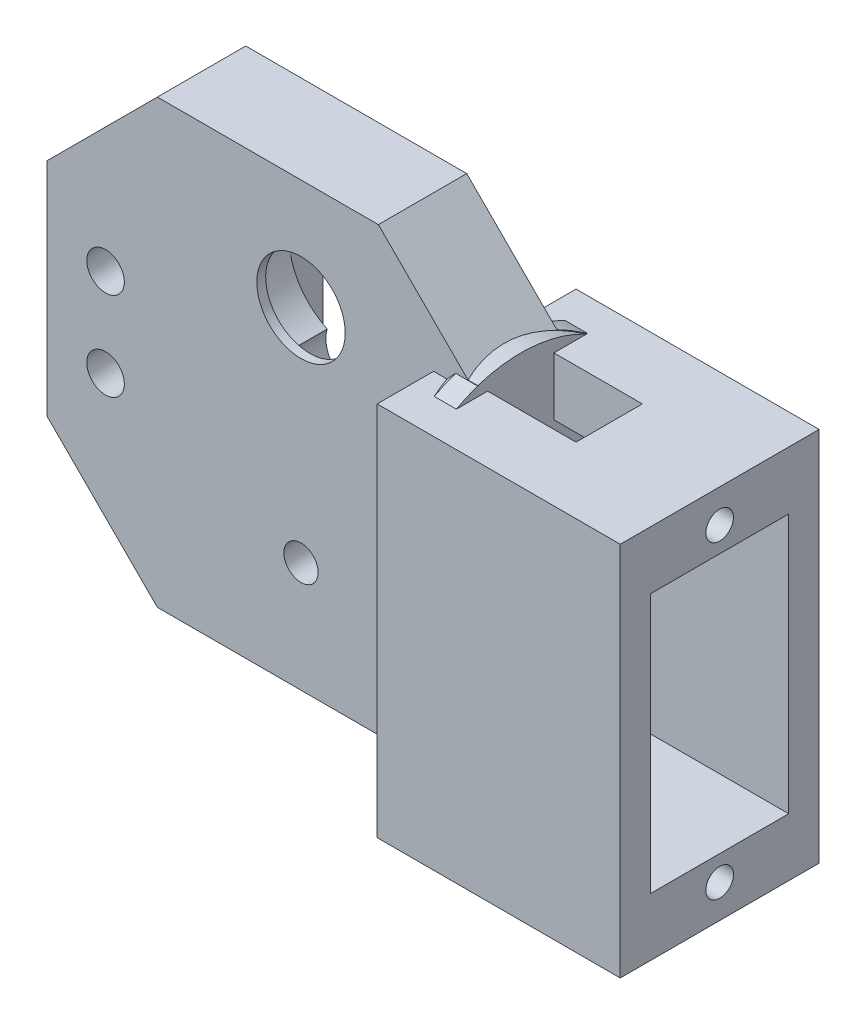
from build123d import *

# Parameters (mm, degrees)
SKETCH_1_W                = 50
SKETCH_1_H                = 40
EXTRUDE_1_DEPTH           = 8
CHAMFER_1_SIZE            = 10
SKETCH_2_R                = 1.55
CUT_EXTRUDE_1_DEPTH       = 10
EXTRUDE_2_DEPTH           = 40
EXTRUDE_2_DEPTH_BACK      = 15
SKETCH_3_R                = 12.5
SKETCH_4_R                = 1.7
CUT_EXTRUDE_2_DEPTH       = 15
CUT_EXTRUDE_START         = -20
CUT_EXTRUDE_3_DEPTH       = 20
SKETCH_7_R                = 16.5
CUT_EXTRUDE_8_DEPTH       = 33
CUT_EXTRUDE_9_DEPTH       = 20
CHAMFER_3_SIZE            = 2
SKETCH_10_OUTSIDE_W       = 47.322
SKETCH_10_OUTSIDE_H       = 62.322
SKETCH_10_OUTSIDE_R       = 12.5
CUT_EXTRUDE_10_DEPTH      = 10
CHAMFER_4_SIZE            = 10
SKETCH_12_W               = 1.5
SKETCH_12_H               = 20
SKETCH_14_W               = 12
SKETCH_14_H               = 23
CUT_EXTRUDE_11_DEPTH      = 3
CUT_EXTRUDE_12_DEPTH      = 4.2
SKETCH_16_R               = 1.1
CUT_EXTRUDE_13_DEPTH      = 5
SKETCH_17_R               = 3.372674955
EXTRUDE_3_DEPTH           = 4
SKETCH_18_R               = 1.1
CUT_EXTRUDE_14_DEPTH      = 4
SKETCH_20_R               = 4
CUT_EXTRUDE_15_DEPTH      = 4
CUT_EXTRUDE_16_DEPTH      = 70.980354503
CUT_EXTRUDE_16_DEPTH_BACK = 70.980354503
SKETCH_21_W               = 56.3061188
SKETCH_21_H               = 46.683670243
EXTRUDE_4_DEPTH           = 18
EXTRUDE_4_DEPTH_BACK      = 4
SKETCH_22_W               = 18
SKETCH_22_H               = 34
SKETCH_23_W               = 12.5
SKETCH_23_H               = 23.5
CUT_EXTRUDE_17_DEPTH      = 18
SKETCH_24_R               = 1.25
CUT_EXTRUDE_18_DEPTH      = 8
CUT_EXTRUDE_19_DEPTH      = 64.641574462
SKETCH_26_W               = 8
SKETCH_26_H               = 6
CUT_EXTRUDE_20_DEPTH      = 20


# Read off the part's stored shape, not the designer's step: 切除-拉伸3
with BuildPart() as part:
    # 草图1 → 凸台-拉伸1 (new body)
    with BuildSketch(Plane.XY):
        Rectangle(SKETCH_1_W, SKETCH_1_H)
    extrude(amount=EXTRUDE_1_DEPTH)

    # 倒角1
    chamfer_1_edges = [part.edges().sort_by_distance(p)[0] for p in [
        (-25, -20, 4),
        (-25, 20, 4),
    ]]
    chamfer(chamfer_1_edges, length=CHAMFER_1_SIZE)

    # 草图2 → 切除-拉伸1 (cut)
    with BuildSketch(Plane.XY.offset(8)):
        with Locations((-2, -10)):
            Circle(SKETCH_2_R)
        with Locations((-2, 10)):
            Circle(SKETCH_2_R)
    extrude(amount=-CUT_EXTRUDE_1_DEPTH, mode=Mode.SUBTRACT)

    # 草图3 → 凸台-拉伸2 (add, two sides: drawn at the far end of the back side and taken through both)
    with BuildSketch(Plane(origin=(25, 0, 0), x_dir=(0, 0, -1), z_dir=(1, 0, 0)).offset(-EXTRUDE_2_DEPTH_BACK)):
        with Locations(Location((-4, 0, 0), (0, 0, 251.337075115))):
            Circle(SKETCH_3_R)
    extrude(amount=EXTRUDE_2_DEPTH + EXTRUDE_2_DEPTH_BACK)

    # 草图4 → 切除-拉伸2 (cut)
    with BuildSketch(Plane.XY.offset(8)):
        with Locations((-19.690178066, -4)):
            Circle(SKETCH_4_R)
        with Locations((-19.690178066, 4)):
            Circle(SKETCH_4_R)
    extrude(amount=-CUT_EXTRUDE_2_DEPTH, mode=Mode.SUBTRACT)

    # 切除-拉伸3 outline → 切除-拉伸3 (cut)
    with BuildSketch(Plane(origin=(65, 0, 0), x_dir=(0, 0, -1), z_dir=(1, 0, 0)).offset(CUT_EXTRUDE_START)):
        with BuildLine():
            Line((7.456439237, -5), (-15.456439237, -5))
            ThreePointArc((-15.456439237, -5), (-4, -12.5), (7.456439237, -5))
        make_face()
        with BuildLine():
            ThreePointArc((7.456439237, 5), (-4, 12.5), (-15.456439237, 5))
            Line((-15.456439237, 5), (7.456439237, 5))
        make_face()
    extrude(amount=CUT_EXTRUDE_3_DEPTH, mode=Mode.SUBTRACT)

    # 草图7 → 切除-拉伸8 (cut)
    with BuildSketch(Plane.XZ.offset(5)):
        with Locations((48.5, 4)):
            Circle(SKETCH_7_R)
    cut_extrude_8 = extrude(amount=CUT_EXTRUDE_8_DEPTH, mode=Mode.SUBTRACT)

    # 镜向1: 切除-拉伸8 across plane
    add(cut_extrude_8.mirror(Plane.ZX), mode=Mode.SUBTRACT)

    # 草图8 → 切除-拉伸9 (cut)
    with BuildSketch(Plane.XZ.offset(5)):
        with BuildLine():
            Line((50, 19.107397707), (75.764252489, 33.62580965))
            Line((75.764252489, 33.62580965), (78.826270749, -18.347337912))
            Line((78.826270749, -18.347337912), (50, -10.892602293))
            ThreePointArc((50, -10.892602293), (65, 4.107397707), (50, 19.107397707))
        make_face()
    extrude(amount=-CUT_EXTRUDE_9_DEPTH, mode=Mode.SUBTRACT)

    # 倒角3
    chamfer_3_edges = [part.edges().sort_by_distance(p)[0] for p in [
        (10, 0, 16.5),
        (10, 0, -8.5),
    ]]
    chamfer(chamfer_3_edges, length=CHAMFER_3_SIZE)

    # 草图10 outside → 切除-拉伸10 (cut)
    with BuildSketch(Plane(origin=(25, 0, 0), x_dir=(0, 0, -1), z_dir=(1, 0, 0))):
        with Locations((-4, 0)):
            Rectangle(SKETCH_10_OUTSIDE_W, SKETCH_10_OUTSIDE_H)
        with Locations((-4.107397707, 0)):
            Circle(SKETCH_10_OUTSIDE_R, mode=Mode.SUBTRACT)
    extrude(amount=-CUT_EXTRUDE_10_DEPTH, mode=Mode.SUBTRACT)

    # 倒角4
    # the kernel refuses this chamfer: 10 mm, written as the material it takes off along each edge
    with BuildSketch(Plane(origin=(15, -20, -25.71682988), x_dir=(-0.9996219169112968, -0.027495876610586317, 0), z_dir=(0, 0, 1))) as chamfer_4_piece_1_section:
        Polygon((CHAMFER_4_SIZE * 0.999621916911, -CHAMFER_4_SIZE * 0.0274958766106), (-CHAMFER_4_SIZE * 0.0274958766106, -CHAMFER_4_SIZE * 0.999621916911), (0, 0), align=None)
    chamfer_4_piece_1 = extrude(amount=59.433659759, mode=Mode.PRIVATE)
    chamfer_4_piece_1 = chamfer_4_piece_1 - Plane(origin=(11.669205873, 0, 4.107397707), x_dir=(0, 0, -1), z_dir=(1, 0, 0)) * Cylinder(12.5, 159, mode=Mode.PRIVATE)
    add(chamfer_4_piece_1, mode=Mode.SUBTRACT)
    with BuildSketch(Plane(origin=(15, 20, 33.71682988), x_dir=(-0.9996219169112968, 0.027495876610586317, 0), z_dir=(0, 0, -1))) as chamfer_4_piece_2_section:
        Polygon((CHAMFER_4_SIZE * 0.999621916911, -CHAMFER_4_SIZE * 0.0274958766106), (-CHAMFER_4_SIZE * 0.0274958766106, -CHAMFER_4_SIZE * 0.999621916911), (0, 0), align=None)
    chamfer_4_piece_2 = extrude(amount=59.433659759, mode=Mode.PRIVATE)
    chamfer_4_piece_2 = chamfer_4_piece_2 - Plane(origin=(11.669205873, 0, 4.107397707), x_dir=(0, 0, -1), z_dir=(1, 0, 0)) * Cylinder(12.5, 159, mode=Mode.PRIVATE)
    add(chamfer_4_piece_2, mode=Mode.SUBTRACT)

    # 草图12 → 切除-旋转2 (revolve, cut)
    with BuildSketch(Plane(origin=(0, 0, 0), x_dir=(1, 0, 0), z_dir=(0, 1, 0))):
        with Locations((14.75, 8.392602293)):
            Rectangle(SKETCH_12_W, SKETCH_12_H)
    revolve(axis=Axis((50, 0, 4.107397707), (-1, 0, 0)), mode=Mode.SUBTRACT)

    # 草图14 → 切除-拉伸11 (cut)
    with BuildSketch(Plane(origin=(0, 0, 0), x_dir=(-1, 0, 0), z_dir=(0, 0, -1))):
        with Locations((2, 4.65)):
            Rectangle(SKETCH_14_W, SKETCH_14_H)
    extrude(amount=-CUT_EXTRUDE_11_DEPTH, mode=Mode.SUBTRACT)

    # 草图15 → 切除-拉伸12 (cut)
    with BuildSketch(Plane(origin=(0, 0, 3), x_dir=(-1, 0, 0), z_dir=(0, 0, -1))):
        with BuildLine():
            ThreePointArc((4.631967524, 4.49702381), (2, 16.1), (-0.631967524, 4.49702381))
            ThreePointArc((-0.631967524, 4.49702381), (2, 0.95), (4.631967524, 4.49702381))
        make_face()
    extrude(amount=-CUT_EXTRUDE_12_DEPTH, mode=Mode.SUBTRACT)

    # 草图16 → 切除-拉伸13 (cut)
    with BuildSketch(Plane(origin=(0, 0, 0), x_dir=(-1, 0, 0), z_dir=(0, 0, -1))):
        with Locations((2, 18.3)):
            Circle(SKETCH_16_R)
    extrude(amount=-CUT_EXTRUDE_13_DEPTH, mode=Mode.SUBTRACT)

    # 草图17 → 凸台-拉伸3 (add)
    with BuildSketch(Plane(origin=(0, 0, 0), x_dir=(-1, 0, 0), z_dir=(0, 0, -1))):
        with Locations((2, -10)):
            Circle(SKETCH_17_R)
    extrude(amount=-EXTRUDE_3_DEPTH)

    # 草图18 → 切除-拉伸14 (cut)
    with BuildSketch(Plane(origin=(0, 0, 0), x_dir=(-1, 0, 0), z_dir=(0, 0, -1))):
        with Locations((2, -9)):
            Circle(SKETCH_18_R)
    extrude(amount=-CUT_EXTRUDE_14_DEPTH, mode=Mode.SUBTRACT)

    # 草图20 → 切除-拉伸15 (cut)
    with BuildSketch(Plane(origin=(0, 0, 7.2), x_dir=(-1, 0, 0), z_dir=(0, 0, -1))):
        with Locations((2, 10)):
            Circle(SKETCH_20_R)
    extrude(amount=-CUT_EXTRUDE_15_DEPTH, mode=Mode.SUBTRACT)

    # 草图21 → 切除-拉伸16 (cut, two sides: drawn at the far end of the back side and taken through both)
    with BuildSketch(Plane(origin=(0, 0, 0), x_dir=(-1, 0, 0), z_dir=(0, 0, -1)).offset(-CUT_EXTRUDE_16_DEPTH_BACK)):
        with Locations((-42.1530594, 7.959183123)):
            Rectangle(SKETCH_21_W, SKETCH_21_H)
    extrude(amount=CUT_EXTRUDE_16_DEPTH + CUT_EXTRUDE_16_DEPTH_BACK, mode=Mode.SUBTRACT)

    # 草图22 → 凸台-拉伸4 (add, two sides: drawn at the far end of the back side and taken through both)
    with BuildSketch(Plane(origin=(14, 0, 0), x_dir=(0, 0, -1), z_dir=(1, 0, 0)).offset(-EXTRUDE_4_DEPTH_BACK)):
        with Locations((-4.107397707, -6)):
            Rectangle(SKETCH_22_W, SKETCH_22_H)
    extrude(amount=EXTRUDE_4_DEPTH + EXTRUDE_4_DEPTH_BACK)

    # 草图23 → 切除-拉伸17 (cut)
    with BuildSketch(Plane(origin=(32, 0, 0), x_dir=(0, 0, -1), z_dir=(1, 0, 0))):
        with Locations((-4.107397707, -6)):
            Rectangle(SKETCH_23_W, SKETCH_23_H)
    extrude(amount=-CUT_EXTRUDE_17_DEPTH, mode=Mode.SUBTRACT)

    # 草图24 → 切除-拉伸18 (cut)
    with BuildSketch(Plane(origin=(32, 0, 0), x_dir=(0, 0, -1), z_dir=(1, 0, 0))):
        with Locations((-4.107397707, 8)):
            Circle(SKETCH_24_R)
        with Locations(Location((-4.107397707, -20, 0), (0, 0, 180))):
            Circle(SKETCH_24_R)
    extrude(amount=-CUT_EXTRUDE_18_DEPTH, mode=Mode.SUBTRACT)

    # 草图25 → 切除-拉伸19 (cut, through all)
    with BuildSketch(Plane(origin=(32, 0, 0), x_dir=(0, 0, -1), z_dir=(1, 0, 0))):
        with BuildLine():
            Line((-13.107397707, -8.561851845), (-13.107397707, 8.561851845))
            ThreePointArc((-13.107397707, 8.561851845), (-16.5, 0), (-13.107397707, -8.561851845))
        make_face()
        with BuildLine():
            Line((4.892602293, -8.784738155), (4.892602293, 8.784738155))
            ThreePointArc((4.892602293, 8.784738155), (8.5, 0), (4.892602293, -8.784738155))
        make_face()
    extrude(amount=-CUT_EXTRUDE_19_DEPTH, mode=Mode.SUBTRACT)

    # 草图26 → 切除-拉伸20 (cut)
    with BuildSketch(Plane.XZ.offset(-5.75)):
        with Locations((18, 4.107397707)):
            Rectangle(SKETCH_26_W, SKETCH_26_H)
    extrude(amount=-CUT_EXTRUDE_20_DEPTH, mode=Mode.SUBTRACT)


solid = part.part
